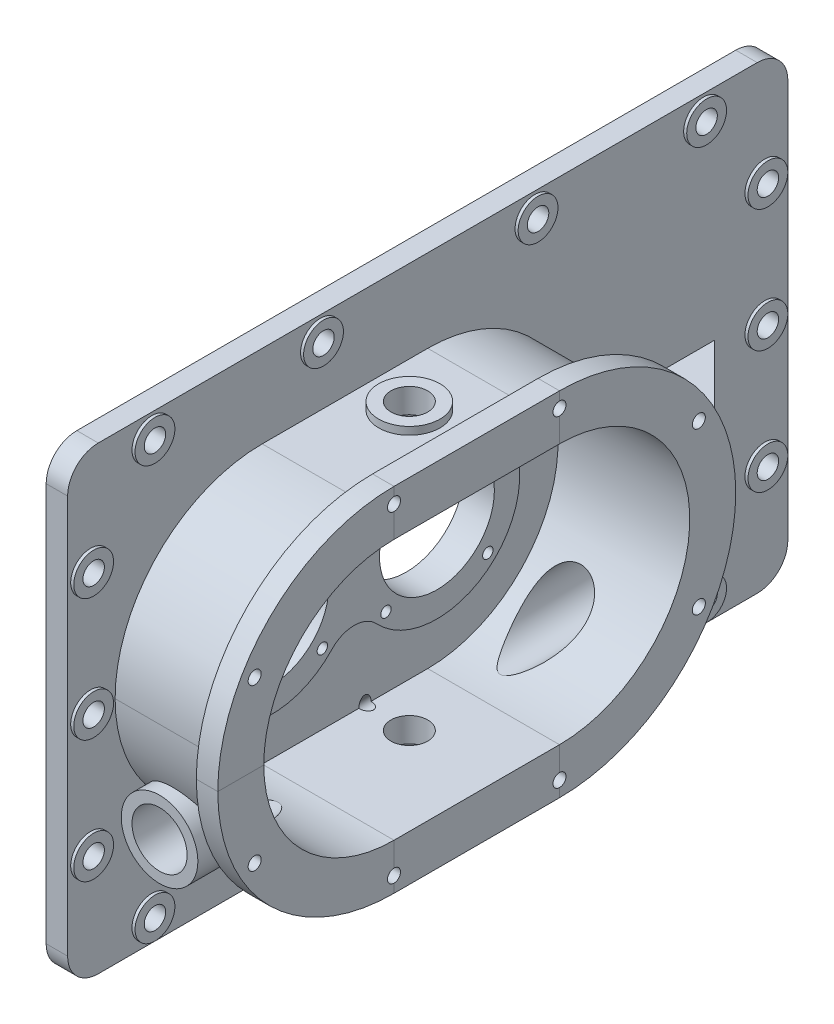
from build123d import *
from build123d.topology import SkipClean

# Parameters (mm, degrees)
SKETCH1_W                                    = 300
SKETCH1_H                                    = 470
BOSS_EXTRUDE1_DEPTH                          = 14
SKETCH6_R                                    = 37.5
CUT_EXTRUDE2_DEPTH                           = 3
BOSS_EXTRUDE2_REACH                          = 476.575
BOSS_EXTRUDE2_END_RADIUS                     = 96
SKETCH7_R                                    = 25
SKETCH7_R_2                                  = 18
BOSS_EXTRUDE3_REACH                          = 377.155
BOSS_EXTRUDE3_END_RADIUS                     = 96
SKETCH8_R                                    = 25
SKETCH8_R_2                                  = 18
SKETCH8_2_R                                  = 18
CUT_EXTRUDE3_DEPTH                           = 298
SKETCH9_R                                    = 20
BOSS_EXTRUDE4_DEPTH                          = 5
CUT_EXTRUDE4_DEPTH                           = 359.086581737
CUT_EXTRUDE4_DEPTH_BACK                      = 359.086581737
SKETCH10_R                                   = 12
FILLET1_R                                    = 20
SKETCH11_R                                   = 13
SKETCH11_R_2                                 = 7
BOSS_EXTRUDE5_DEPTH                          = 2
CUT_EXTRUDE5_START                           = -292.755034262
SKETCH11_3_R                                 = 7
CUT_EXTRUDE5_DEPTH                           = 312.755034262
MIRROR2_AT_THE_SECOND_PLANE_COPY_1_SKETC_R   = 13
MIRROR2_AT_THE_SECOND_PLANE_COPY_1_SKETC_R_2 = 7
MIRROR2_AT_THE_SECOND_PLANE_COPY_1_DEPTH     = 2
MIRROR3_START                                = -292.755034262
MIRROR3_AT_THE_SECOND_PLANE_COPY_1_SKETC_R   = 7
MIRROR3_AT_THE_SECOND_PLANE_COPY_1_DEPTH     = 312.755034262
SKETCH20_R                                   = 4
CUT_EXTRUDE6_DEPTH                           = 414.545878258
RIB1_REACH                                   = 298.184
SKETCH21_WALL_W                              = 696.191505344
SKETCH21_WALL_H                              = 14
SKETCH22_W                                   = 220
SKETCH22_H                                   = 390
CUT_EXTRUDE9_DEPTH                           = 3
SKETCH23_R                                   = 37.5
BOSS_EXTRUDE6_DEPTH                          = 3
FILLET3_R                                    = 10
BOSS_EXTRUDE7_START                          = 6
SKETCH27_R                                   = 37.5
BOSS_EXTRUDE7_DEPTH                          = 6
CUT_EXTRUDE11_DEPTH                          = 292.755034262
CUT_EXTRUDE11_DEPTH_BACK                     = 292.755034262
SKETCH27_2_R                                 = 37.5
TAP_DRILL_FOR_M8_TAP1_D                      = 6.8
TAP_START                                    = 86
TAP_DRILL_FOR_M10_TAP1_OUTLINE_R             = 4.25
TAP_DRILL_FOR_M10_TAP1_DEPTH                 = 14


# Read off the part's stored shape, not the designer's step: Tap Drill for M10 Tap1
with BuildPart() as part:
    # Sketch1 → Boss-Extrude1 (new body)
    with BuildSketch(Plane.YZ):
        Rectangle(SKETCH1_W, SKETCH1_H)
    extrude(amount=BOSS_EXTRUDE1_DEPTH)

    # Sweep2: sweep along a curve in space
    with BuildLine() as sweep2_path:
        Line((14, -85, 108), (14, -85, 0))
        ThreePointArc((14, -85, 0), (14, 0, -85), (14, 85, 0))
        Line((14, 85, 0), (14, 85, 108))
        ThreePointArc((14, 85, 108), (14, 0, 193), (14, -85, 108))
    # Sketch4 → Sweep2 (sweep)
    with BuildSketch(Plane(origin=(0, 0, 0), x_dir=(-1, 0, 0), z_dir=(0, 1, 0))):
        Polygon((-14, 193), (-100, 193), (-100, 223), (-86, 223), (-86, 204), (-14, 204), align=None)
    sweep(path=sweep2_path.line)

    # Sketch6 → Cut-Extrude2 (cut)
    with BuildSketch(Plane(origin=(0, 0, 0), x_dir=(0, -1, 0), z_dir=(-1, 0, 0))):
        with BuildLine():
            ThreePointArc((-36.921728357, 39.405405405), (0, -54), (36.921728357, 39.405405405))
            ThreePointArc((36.921728357, 39.405405405), (30.596442563, 54), (36.921728357, 68.594594595))
            ThreePointArc((36.921728357, 68.594594595), (0, 162), (-36.921728357, 68.594594595))
            ThreePointArc((-36.921728357, 68.594594595), (-30.596442563, 54), (-36.921728357, 39.405405405))
        make_face()
        with Locations(Location((0, 108, 0), (0, 0, 90))):
            Circle(SKETCH6_R, mode=Mode.SUBTRACT)
        with Locations(Location((0, 0, 0), (0, 0, 90))):
            Circle(SKETCH6_R, mode=Mode.SUBTRACT)
    extrude(amount=-CUT_EXTRUDE2_DEPTH, mode=Mode.SUBTRACT)

    # Boss-Extrude2: up to this cylinder (the profile starts outside it)
    boss_extrude2_end = Plane(origin=(18.707107, 0, 108), z_dir=(-1, 0, 0)) * Cylinder(BOSS_EXTRUDE2_END_RADIUS, 1146.15, mode=Mode.PRIVATE)
    # Sketch7 → Boss-Extrude2 (add, up to the surface)
    with BuildSketch(Plane.XY.offset(204), mode=Mode.PRIVATE) as boss_extrude2_sk1:
        with Locations((43, -65)):
            Circle(SKETCH7_R)
        with Locations((43, -65)):
            Circle(SKETCH7_R_2, mode=Mode.SUBTRACT)
    boss_extrude2_tool1 = extrude(boss_extrude2_sk1.sketch, amount=-BOSS_EXTRUDE2_REACH, mode=Mode.PRIVATE) - boss_extrude2_end
    add(boss_extrude2_tool1.solids().sort_by_distance((18.707107, -65, 204))[0])

    # Boss-Extrude3: up to this cylinder (the profile starts outside it)
    boss_extrude3_end = Plane(origin=(18.707107, 0, 0), z_dir=(-1, 0, 0)) * Cylinder(BOSS_EXTRUDE3_END_RADIUS, 947.31, mode=Mode.PRIVATE)
    # Sketch8 → Boss-Extrude3 (add, up to the surface)
    with BuildSketch(Plane.XY.offset(-94), mode=Mode.PRIVATE) as boss_extrude3_sk1:
        with Locations((43, -65)):
            Circle(SKETCH8_R)
        with Locations((43, -65)):
            Circle(SKETCH8_R_2, mode=Mode.SUBTRACT)
    boss_extrude3_tool1 = extrude(boss_extrude3_sk1.sketch, amount=BOSS_EXTRUDE3_REACH, mode=Mode.PRIVATE) - boss_extrude3_end
    add(boss_extrude3_tool1.solids().sort_by_distance((18.707107, -65, -94))[0])

    # Sketch8<2> → Cut-Extrude3 (cut)
    with BuildSketch(Plane.XY.offset(-94)):
        with Locations((43, -65)):
            Circle(SKETCH8_2_R)
    extrude(amount=CUT_EXTRUDE3_DEPTH, mode=Mode.SUBTRACT)

    # Sketch9 → Boss-Extrude4 (add)
    with BuildSketch(Plane.XZ.offset(96)):
        with Locations(Location((43, 41, 0), (0, 0, 270))):
            Circle(SKETCH9_R)
    boss_extrude4 = extrude(amount=BOSS_EXTRUDE4_DEPTH)

    # Mirror1: Boss-Extrude4 across plane
    add(boss_extrude4.mirror(Plane.ZX))

    # Sketch10 → Cut-Extrude4 (cut, two sides: drawn at the far end of the back side and taken through both)
    with BuildSketch(Plane.XZ.offset(101).offset(-CUT_EXTRUDE4_DEPTH_BACK)):
        with Locations((43, 41)):
            Circle(SKETCH10_R)
    extrude(amount=CUT_EXTRUDE4_DEPTH + CUT_EXTRUDE4_DEPTH_BACK, mode=Mode.SUBTRACT)

    # Fillet1
    fillet1_edges = [part.edges().sort_by_distance(p)[0] for p in [
        (7, -150, 235),
        (7, 150, 235),
        (7, 150, -235),
        (7, -150, -235),
    ]]
    fillet(fillet1_edges, radius=FILLET1_R)

    # Sketch11 → Boss-Extrude5 (add)
    # profile 1 of 4: a face of its own
    with BuildSketch(Plane.YZ.offset(14)):
        with Locations(Location((-135, 180, 0), (0, 0, 270))):
            Circle(SKETCH11_R)
        with Locations(Location((-135, 180, 0), (0, 0, 270))):
            Circle(SKETCH11_R_2, mode=Mode.SUBTRACT)
    # profile 2 of 4: a face of its own
    with BuildSketch(Plane.YZ.offset(14)):
        with Locations(Location((-135, 70, 0), (0, 0, 270))):
            Circle(SKETCH11_R)
        with Locations(Location((-135, 70, 0), (0, 0, 270))):
            Circle(SKETCH11_R_2, mode=Mode.SUBTRACT)
    # profile 3 of 4: a face of its own
    with BuildSketch(Plane.YZ.offset(14)):
        with Locations(Location((-80, 220, 0), (0, 0, 270))):
            Circle(SKETCH11_R)
        with Locations(Location((-80, 220, 0), (0, 0, 270))):
            Circle(SKETCH11_R_2, mode=Mode.SUBTRACT)
    # profile 4 of 4: a face of its own
    with BuildSketch(Plane.YZ.offset(14)):
        with Locations(Location((0, 220, 0), (0, 0, 270))):
            Circle(SKETCH11_R)
        with Locations(Location((0, 220, 0), (0, 0, 270))):
            Circle(SKETCH11_R_2, mode=Mode.SUBTRACT)
    boss_extrude5 = extrude(amount=BOSS_EXTRUDE5_DEPTH)

    # Sketch11<3> → Cut-Extrude5 (cut)
    with BuildSketch(Plane.YZ.offset(14).offset(CUT_EXTRUDE5_START)):
        with Locations(Location((-135, 180, 0), (0, 0, 270))):
            Circle(SKETCH11_3_R)
        with Locations(Location((-80, 220, 0), (0, 0, 270))):
            Circle(SKETCH11_3_R)
        with Locations(Location((-135, 70, 0), (0, 0, 270))):
            Circle(SKETCH11_3_R)
        with Locations(Location((0, 220, 0), (0, 0, 270))):
            Circle(SKETCH11_3_R)
    cut_extrude5 = extrude(amount=CUT_EXTRUDE5_DEPTH, mode=Mode.SUBTRACT)

    # Mirror2: Boss-Extrude5 across plane
    add(boss_extrude5.mirror(Plane.XY))

    # Mirror2 at the second plane: Boss-Extrude5 across plane
    add(boss_extrude5.mirror(Plane.ZX))

    # Mirror2 at the second plane copy 1 sketc → Mirror2 at the second plane copy 1 (add)
    # profile 1 of 4: a face of its own
    with BuildSketch(Plane(origin=(14, 0, 0), x_dir=(0, -1, 0), z_dir=(1, 0, 0))):
        with Locations(Location((-135, 180, 0), (0, 0, 270))):
            Circle(MIRROR2_AT_THE_SECOND_PLANE_COPY_1_SKETC_R)
        with Locations(Location((-135, 180, 0), (0, 0, 270))):
            Circle(MIRROR2_AT_THE_SECOND_PLANE_COPY_1_SKETC_R_2, mode=Mode.SUBTRACT)
    # profile 2 of 4: a face of its own
    with BuildSketch(Plane(origin=(14, 0, 0), x_dir=(0, -1, 0), z_dir=(1, 0, 0))):
        with Locations(Location((-135, 70, 0), (0, 0, 270))):
            Circle(MIRROR2_AT_THE_SECOND_PLANE_COPY_1_SKETC_R)
        with Locations(Location((-135, 70, 0), (0, 0, 270))):
            Circle(MIRROR2_AT_THE_SECOND_PLANE_COPY_1_SKETC_R_2, mode=Mode.SUBTRACT)
    # profile 3 of 4: a face of its own
    with BuildSketch(Plane(origin=(14, 0, 0), x_dir=(0, -1, 0), z_dir=(1, 0, 0))):
        with Locations(Location((-80, 220, 0), (0, 0, 270))):
            Circle(MIRROR2_AT_THE_SECOND_PLANE_COPY_1_SKETC_R)
        with Locations(Location((-80, 220, 0), (0, 0, 270))):
            Circle(MIRROR2_AT_THE_SECOND_PLANE_COPY_1_SKETC_R_2, mode=Mode.SUBTRACT)
    # profile 4 of 4: a face of its own
    with BuildSketch(Plane(origin=(14, 0, 0), x_dir=(0, -1, 0), z_dir=(1, 0, 0))):
        with Locations(Location((0, 220, 0), (0, 0, 270))):
            Circle(MIRROR2_AT_THE_SECOND_PLANE_COPY_1_SKETC_R)
        with Locations(Location((0, 220, 0), (0, 0, 270))):
            Circle(MIRROR2_AT_THE_SECOND_PLANE_COPY_1_SKETC_R_2, mode=Mode.SUBTRACT)
    extrude(amount=MIRROR2_AT_THE_SECOND_PLANE_COPY_1_DEPTH)

    # Mirror3: Cut-Extrude5 across plane
    add(cut_extrude5.mirror(Plane.XY), mode=Mode.SUBTRACT)

    # Mirror3 at the second plane: Cut-Extrude5 across plane
    add(cut_extrude5.mirror(Plane.ZX), mode=Mode.SUBTRACT)

    # Mirror3 at the second plane copy 1 sketc → Mirror3 at the second plane copy 1 (cut)
    with BuildSketch(Plane(origin=(14, 0, 0), x_dir=(0, -1, 0), z_dir=(1, 0, 0)).offset(MIRROR3_START)):
        with Locations(Location((-135, 180, 0), (0, 0, 270))):
            Circle(MIRROR3_AT_THE_SECOND_PLANE_COPY_1_SKETC_R)
        with Locations(Location((-80, 220, 0), (0, 0, 270))):
            Circle(MIRROR3_AT_THE_SECOND_PLANE_COPY_1_SKETC_R)
        with Locations(Location((-135, 70, 0), (0, 0, 270))):
            Circle(MIRROR3_AT_THE_SECOND_PLANE_COPY_1_SKETC_R)
        with Locations(Location((0, 220, 0), (0, 0, 270))):
            Circle(MIRROR3_AT_THE_SECOND_PLANE_COPY_1_SKETC_R)
    extrude(amount=MIRROR3_AT_THE_SECOND_PLANE_COPY_1_DEPTH, mode=Mode.SUBTRACT)

    # Sketch20 → Cut-Extrude6 (cut, symmetric)
    with BuildSketch(Plane(origin=(-30.126114411, -129.126114411, 41), x_dir=(-0.7071067811865475, 0.7071067811865477, 0), z_dir=(-0.7071067811865477, -0.7071067811865475, 0))):
        with Locations(Location((0, 0, 0), (0, 0, 180))):
            Circle(SKETCH20_R)
    cut_extrude6 = extrude(amount=CUT_EXTRUDE6_DEPTH, both=True, mode=Mode.SUBTRACT)

    # Mirror5: Cut-Extrude6 across plane
    add(cut_extrude6.mirror(Plane.ZX), mode=Mode.SUBTRACT)

    # Sketch21 wall → Rib1 (add, up to next)
    with BuildSketch(Plane(origin=(50, 0, -151), x_dir=(-0.707106781187, 0, -0.707106781187), z_dir=(-0.707106781187, 0, 0.707106781187)), mode=Mode.PRIVATE) as rib1_sk1:
        Rectangle(SKETCH21_WALL_W, SKETCH21_WALL_H)
    rib1_tool1 = extrude(rib1_sk1.sketch, amount=RIB1_REACH, mode=Mode.PRIVATE) - part.part
    add(rib1_tool1.solids().sort_by_distance((50, 0, -151))[0])

    # Sketch22 → Cut-Extrude9 (cut)
    with BuildSketch(Plane(origin=(0, 0, 0), x_dir=(0, -1, 0), z_dir=(-1, 0, 0))):
        Rectangle(SKETCH22_W, SKETCH22_H)
    extrude(amount=-CUT_EXTRUDE9_DEPTH, mode=Mode.SUBTRACT)

    # Sketch23 → Boss-Extrude6 (add, through all)
    with BuildSketch(Plane(origin=(3, 0, 0), x_dir=(0, -1, 0), z_dir=(-1, 0, 0))):
        with BuildLine():
            ThreePointArc((-36.921728357, 39.405405405), (0, -54), (36.921728357, 39.405405405))
            ThreePointArc((36.921728357, 39.405405405), (30.596442563, 54), (36.921728357, 68.594594595))
            ThreePointArc((36.921728357, 68.594594595), (0, 162), (-36.921728357, 68.594594595))
            ThreePointArc((-36.921728357, 68.594594595), (-30.596442563, 54), (-36.921728357, 39.405405405))
        make_face()
        with Locations(Location((0, 108, 0), (0, 0, 90))):
            Circle(SKETCH23_R, mode=Mode.SUBTRACT)
        with Locations(Location((0, 0, 0), (0, 0, 90))):
            Circle(SKETCH23_R, mode=Mode.SUBTRACT)
    extrude(amount=BOSS_EXTRUDE6_DEPTH)

    # Fillet3
    fillet3_edges = [part.edges().sort_by_distance(p)[0] for p in [
        (1.5, 110, -195),
        (1.5, 110, 195),
        (1.5, -110, 195),
        (1.5, -110, -195),
    ]]
    fillet(fillet3_edges, radius=FILLET3_R)

    # Sketch27 → Boss-Extrude7 (add)
    with BuildSketch(Plane.YZ.offset(14).offset(BOSS_EXTRUDE7_START)):
        with BuildLine():
            ThreePointArc((36.921728357, 68.594594595), (30.596442563, 54), (36.921728357, 39.405405405))
            ThreePointArc((36.921728357, 39.405405405), (0, -54), (-36.921728357, 39.405405405))
            ThreePointArc((-36.921728357, 39.405405405), (-30.596442563, 54), (-36.921728357, 68.594594595))
            ThreePointArc((-36.921728357, 68.594594595), (0, 162), (36.921728357, 68.594594595))
        make_face()
        with Locations(Location((0, 0, 0), (0, 0, 90))):
            Circle(SKETCH27_R, mode=Mode.SUBTRACT)
        with Locations(Location((0, 108, 0), (0, 0, 90))):
            Circle(SKETCH27_R, mode=Mode.SUBTRACT)
    extrude(amount=-BOSS_EXTRUDE7_DEPTH)

    # Sketch27<2> → Cut-Extrude11 (cut, two sides: drawn at the far end of the back side and taken through both)
    with SkipClean():  # the faces are left unmerged after this step: merging them gives an invalid solid
        with BuildSketch(Plane.YZ.offset(14).offset(-CUT_EXTRUDE11_DEPTH_BACK)):
            with Locations(Location((0, 108, 0), (0, 0, 270))):
                Circle(SKETCH27_2_R)
            with Locations(Location((0, 0, 0), (0, 0, 270))):
                Circle(SKETCH27_2_R)
        extrude(amount=CUT_EXTRUDE11_DEPTH + CUT_EXTRUDE11_DEPTH_BACK, mode=Mode.SUBTRACT)

    # Tap Drill for M8 Tap1 (through all)
    with Locations(Plane(origin=(0, 0, 0), x_dir=(0, -1, 0), z_dir=(-1, 0, 0))):
        with Locations((-33.234018716, 141.234018716), (-33.234018716, -33.234018716), (-33.234018716, 33.234018716), (33.234018716, -33.234018716), (33.234018716, 33.234018716), (33.234018716, 141.234018716), (33.234018716, 74.765981284), (-33.234018716, 74.765981284)):
            Hole(TAP_DRILL_FOR_M8_TAP1_D / 2)

    # Tap Drill for M10 Tap1 outline → Tap Drill for M10 Tap1 (cut)
    with SkipClean():  # the faces are left unmerged after this step: merging them gives an invalid solid
        with BuildSketch(Plane.YZ.offset(TAP_START)):
            with Locations((-105, 108)):
                Circle(TAP_DRILL_FOR_M10_TAP1_OUTLINE_R)
            with Locations((-52.5, -90.932667397)):
                Circle(TAP_DRILL_FOR_M10_TAP1_OUTLINE_R)
            with Locations((52.5, -90.932667397)):
                Circle(TAP_DRILL_FOR_M10_TAP1_OUTLINE_R)
            with Locations((105, 108)):
                Circle(TAP_DRILL_FOR_M10_TAP1_OUTLINE_R)
            with Locations((52.5, 198.932667397)):
                Circle(TAP_DRILL_FOR_M10_TAP1_OUTLINE_R)
            with Locations((-52.5, 198.932667397)):
                Circle(TAP_DRILL_FOR_M10_TAP1_OUTLINE_R)
            with Locations((105, 0)):
                Circle(TAP_DRILL_FOR_M10_TAP1_OUTLINE_R)
            with Locations((-105, 0)):
                Circle(TAP_DRILL_FOR_M10_TAP1_OUTLINE_R)
        extrude(amount=TAP_DRILL_FOR_M10_TAP1_DEPTH, mode=Mode.SUBTRACT)


solid = part.part
